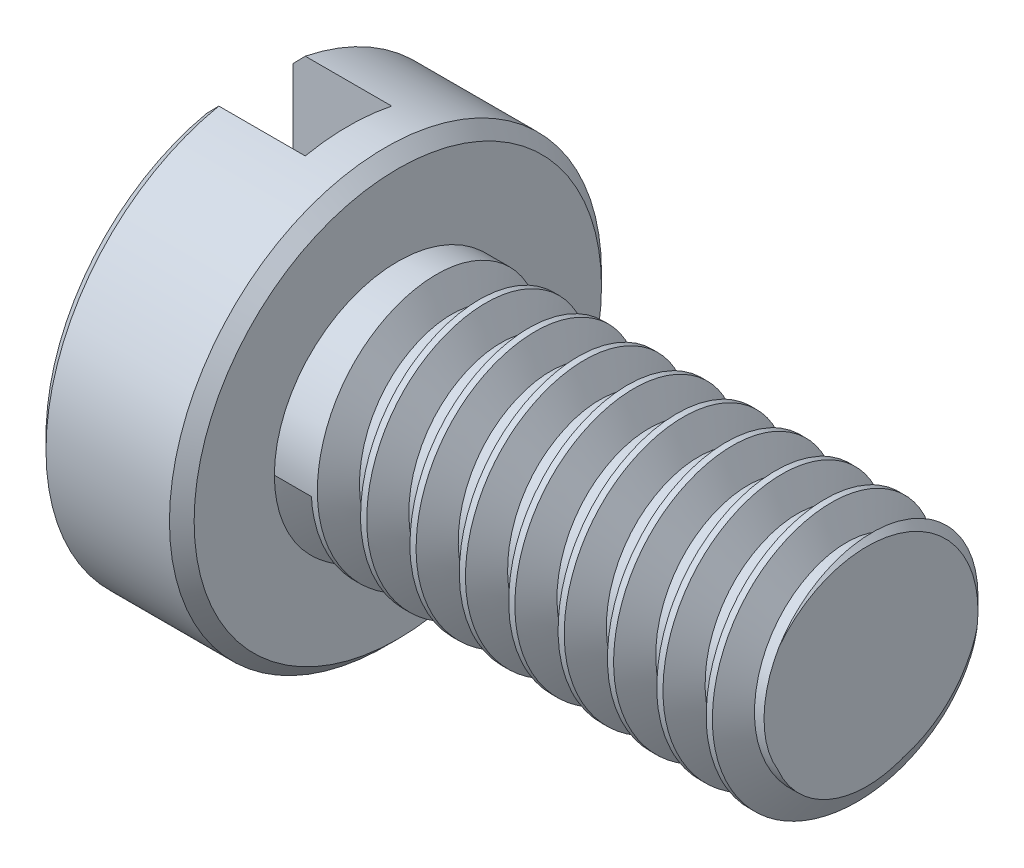
from build123d import *

# Parameters (mm, degrees)
CHAMFER_1_SIZE      = 0.1
SKETCH_2_W          = 0.7
SKETCH_2_H          = 3.5
CUT_EXTRUDE_1_DEPTH = 0.8
THREAD_1_PITCH      = 0.4


with BuildPart() as part:
    # Sketch 1 → Повернуть1 (revolve)
    with BuildSketch(Plane.XY, mode=Mode.PRIVATE) as revolve_1_sk:
        Polygon((0, 0), (0, -1.75), (1.2, -1.75), (1.2, -1), (5, -1), (5, 0), align=None)
    revolve(revolve_1_sk.sketch.rotate(Axis((0, 0, 0), (1, 0, 0)), 270), axis=Axis((0, 0, 0), (1, 0, 0)))

    # Фаска1
    chamfer_1_edges = [part.edges().sort_by_distance(p)[0] for p in [
        (5, 0, -1),
        (1.2, 0, -1.75),
        (0, 0, -1.75),
    ]]
    chamfer(chamfer_1_edges, length=CHAMFER_1_SIZE)

    # Эскиз2 → Вырез-Вытянуть1 (cut)
    with BuildSketch(Plane.ZY):
        Rectangle(SKETCH_2_W, SKETCH_2_H)
    extrude(amount=-CUT_EXTRUDE_1_DEPTH, mode=Mode.SUBTRACT)

    # Резьба1: the profile of Sketch 1 2 profile screwed along a right-hand helix of 11 turns, 6 arcs to a turn; built about Z, then put on its axis
    thread_1_z = Axis((0, 0, 0), (0, 0, 1))
    thread_1_corners = [(1.0003, 0, -0.000173205), (1.0003, 0, 0.350173204), (0.78349365, 0, 0.224999999), (0.78349365, 0, 0.124999999)]
    with BuildLine(mode=Mode.PRIVATE) as thread_1_profile:
        Line(thread_1_corners[0], thread_1_corners[1])
        Line(thread_1_corners[1], thread_1_corners[2])
        Line(thread_1_corners[2], thread_1_corners[3])
        Line(thread_1_corners[3], thread_1_corners[0])
    thread_1_cap = Face(thread_1_profile.wire())
    thread_1_turn_angles = [0, 30, 60, 90, 120, 150, 180, 210, 240, 270, 300, 330, 360]
    thread_1_turn_weights = [1, 0.8660254037844387, 1, 0.8660254037844387, 1, 0.8660254037844387, 1, 0.8660254037844387, 1, 0.8660254037844387, 1, 0.8660254037844387, 1]
    thread_1_turn_rails = [Edge.make_bspline([Vector(p[0], p[1], 0).rotate(thread_1_z, thread_1_turn_angles[k]) / thread_1_turn_weights[k] + Vector(0, 0, p[2] + THREAD_1_PITCH * thread_1_turn_angles[k] / 360) for k in range(13)], [0, 0, 0, 1, 1, 2, 2, 3, 3, 4, 4, 5, 5, 6, 6, 6], 2, thread_1_turn_weights) for p in thread_1_corners]
    thread_1_turn_sides = [Face.make_surface_from_curves(thread_1_turn_rails[p[0]], thread_1_turn_rails[p[1]]) for p in [(0, 1), (1, 2), (2, 3), (3, 0)]]
    thread_1 = Plane(origin=(5.9, 0, 0), x_dir=(0, 0, 1), z_dir=(-1, 0, 0)) * Solid(Shell([*[p.moved(Location((0, 0, THREAD_1_PITCH * i))) for i in range(11) for p in thread_1_turn_sides], thread_1_cap, thread_1_cap.rotate(thread_1_z, 3960).moved(Location((0, 0, THREAD_1_PITCH * 3960 / 360)))]))
    add(thread_1, mode=Mode.SUBTRACT)


solid = part.part
